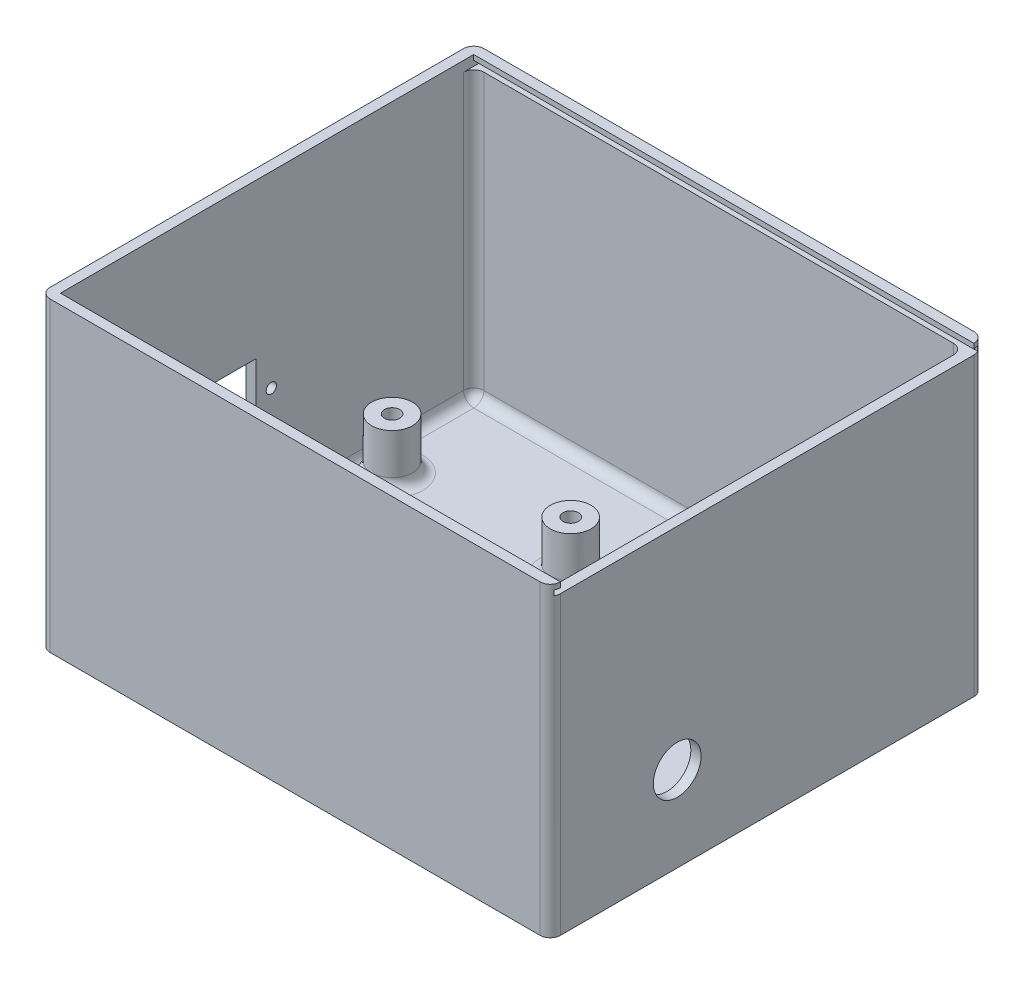
from build123d import *

# Parameters (mm, degrees)
SKETCH2_W           = 100
SKETCH2_H           = 85
BOSS_EXTRUDE1_DEPTH = 60
SHELL1_T            = -2
SKETCH3_R           = 4
SKETCH3_R_2         = 1.5
BOSS_EXTRUDE2_DEPTH = 10
SKETCH4_R           = 1
SKETCH4_W           = 20
SKETCH4_H           = 13
CUT_EXTRUDE1_DEPTH  = 10
SKETCH5_R           = 4.675055564
CUT_EXTRUDE2_DEPTH  = 10
SKETCH6_W           = 81
SKETCH6_H           = 2
CUT_EXTRUDE3_DEPTH  = 10
SKETCH7_W           = 98
SKETCH7_H           = 1
CUT_EXTRUDE4_DEPTH  = 1
SKETCH8_W           = 98
SKETCH8_H           = 1
CUT_EXTRUDE5_DEPTH  = 1
FILLET1_R           = 2


with BuildPart() as part:
    # Sketch2 → Boss-Extrude1 (new body)
    with BuildSketch(Plane(origin=(0, 0, 0), x_dir=(1, 0, 0), z_dir=(0, 1, 0))):
        with Locations((50, 42.5)):
            Rectangle(SKETCH2_W, SKETCH2_H)
    extrude(amount=BOSS_EXTRUDE1_DEPTH)

    # Shell1
    shell1_openings = [part.faces().sort_by_distance(p)[0] for p in [
        (50, 60, -42.5),
    ]]
    offset(amount=SHELL1_T, openings=shell1_openings, kind=Kind.INTERSECTION)

    # Sketch3 → Boss-Extrude2 (add)
    # profile 1 of 6: a face of its own
    with BuildSketch(Plane(origin=(0, 2, 0), x_dir=(1, 0, 0), z_dir=(0, 1, 0))):
        with Locations(Location((7, 62, 0), (0, 0, 90))):
            Circle(SKETCH3_R)
        with Locations(Location((7, 62, 0), (0, 0, 270))):
            Circle(SKETCH3_R_2, mode=Mode.SUBTRACT)
    # profile 2 of 6: a face of its own
    with BuildSketch(Plane(origin=(0, 2, 0), x_dir=(1, 0, 0), z_dir=(0, 1, 0))):
        with Locations(Location((7, 12, 0), (0, 0, 90))):
            Circle(SKETCH3_R)
        with Locations(Location((7, 12, 0), (0, 0, 270))):
            Circle(SKETCH3_R_2, mode=Mode.SUBTRACT)
    # profile 3 of 6: a face of its own
    with BuildSketch(Plane(origin=(0, 2, 0), x_dir=(1, 0, 0), z_dir=(0, 1, 0))):
        with Locations(Location((42, 12, 0), (0, 0, 90))):
            Circle(SKETCH3_R)
        with Locations(Location((42, 12, 0), (0, 0, 270))):
            Circle(SKETCH3_R_2, mode=Mode.SUBTRACT)
    # profile 4 of 6: a face of its own
    with BuildSketch(Plane(origin=(0, 2, 0), x_dir=(1, 0, 0), z_dir=(0, 1, 0))):
        with Locations(Location((42, 62, 0), (0, 0, 90))):
            Circle(SKETCH3_R)
        with Locations(Location((42, 62, 0), (0, 0, 270))):
            Circle(SKETCH3_R_2, mode=Mode.SUBTRACT)
    # profile 5 of 6: a face of its own
    with BuildSketch(Plane(origin=(0, 2, 0), x_dir=(1, 0, 0), z_dir=(0, 1, 0))):
        with Locations(Location((71, 7, 0), (0, 0, 90))):
            Circle(SKETCH3_R)
        with Locations(Location((71, 7, 0), (0, 0, 270))):
            Circle(SKETCH3_R_2, mode=Mode.SUBTRACT)
    # profile 6 of 6: a face of its own
    with BuildSketch(Plane(origin=(0, 2, 0), x_dir=(1, 0, 0), z_dir=(0, 1, 0))):
        with Locations(Location((71, 77, 0), (0, 0, 90))):
            Circle(SKETCH3_R)
        with Locations(Location((71, 77, 0), (0, 0, 270))):
            Circle(SKETCH3_R_2, mode=Mode.SUBTRACT)
    extrude(amount=BOSS_EXTRUDE2_DEPTH)

    # Sketch4 → Cut-Extrude1 (cut)
    with BuildSketch(Plane.ZY):
        with Locations((-43.331926362, 23.212680524)):
            Circle(SKETCH4_R)
        with Locations((-17.331926362, 23.212680524)):
            Circle(SKETCH4_R)
        with Locations((-30.331926362, 23.212680524)):
            Rectangle(SKETCH4_W, SKETCH4_H)
    extrude(amount=-CUT_EXTRUDE1_DEPTH, mode=Mode.SUBTRACT)

    # Sketch5 → Cut-Extrude2 (cut)
    with BuildSketch(Plane(origin=(100, 0, 0), x_dir=(0, 0, -1), z_dir=(1, 0, 0))):
        with Locations((24.873306917, 16.664667804)):
            Circle(SKETCH5_R)
    extrude(amount=-CUT_EXTRUDE2_DEPTH, mode=Mode.SUBTRACT)

    # Sketch6 → Cut-Extrude3 (cut)
    with BuildSketch(Plane(origin=(100, 0, 0), x_dir=(0, 0, -1), z_dir=(1, 0, 0))):
        with Locations((42.5, 59)):
            Rectangle(SKETCH6_W, SKETCH6_H)
    extrude(amount=-CUT_EXTRUDE3_DEPTH, mode=Mode.SUBTRACT)

    # Sketch7 → Cut-Extrude4 (cut)
    with BuildSketch(Plane.XY.offset(-83)):
        with Locations((51, 58.5)):
            Rectangle(SKETCH7_W, SKETCH7_H)
    extrude(amount=-CUT_EXTRUDE4_DEPTH, mode=Mode.SUBTRACT)

    # Sketch8 → Cut-Extrude5 (cut)
    with BuildSketch(Plane(origin=(0, 0, -2), x_dir=(-1, 0, 0), z_dir=(0, 0, -1))):
        with Locations((-51, 58.5)):
            Rectangle(SKETCH8_W, SKETCH8_H)
    extrude(amount=-CUT_EXTRUDE5_DEPTH, mode=Mode.SUBTRACT)

    # Fillet1
    # the kernel refuses this fillet: 2 mm, written as the material it adds along each edge
    with BuildSketch(Plane(origin=(4, 4, -4), x_dir=(0, -1, 0), z_dir=(0, 0, 1))) as fillet1_piece_1_section:
        Polygon((0, 0), (FILLET1_R * 1.02, 0), (FILLET1_R * 1.02, -FILLET1_R * 1.02), (0, -FILLET1_R * 1.02), align=None)
    fillet1_piece_1 = extrude(amount=FILLET1_R * 1.02, mode=Mode.PRIVATE)
    fillet1_piece_1 = fillet1_piece_1 - Plane(origin=(4, 4, -4), x_dir=(0.7071067811865475, 0.7071067811865475, 0), z_dir=(0, 0, 1)) * Sphere(FILLET1_R, mode=Mode.PRIVATE)
    add(fillet1_piece_1)
    with BuildSketch(Plane(origin=(96, 4, -4), x_dir=(0, -1, 0), z_dir=(0, 0, 1))) as fillet1_piece_2_section:
        Polygon((0, 0), (FILLET1_R * 1.02, 0), (FILLET1_R * 1.02, FILLET1_R * 1.02), (0, FILLET1_R * 1.02), align=None)
    fillet1_piece_2 = extrude(amount=FILLET1_R * 1.02, mode=Mode.PRIVATE)
    fillet1_piece_2 = fillet1_piece_2 - Plane(origin=(96, 4, -4), x_dir=(-0.7071067811865475, 0.7071067811865475, 0), z_dir=(0, 0, 1)) * Sphere(FILLET1_R, mode=Mode.PRIVATE)
    add(fillet1_piece_2)
    with BuildSketch(Plane(origin=(96, 4, -81), x_dir=(1, 0, 0), z_dir=(0, -1, 0))) as fillet1_piece_3_section:
        Polygon((0, 0), (FILLET1_R * 1.02, 0), (FILLET1_R * 1.02, -FILLET1_R * 1.02), (0, -FILLET1_R * 1.02), align=None)
    fillet1_piece_3 = extrude(amount=FILLET1_R * 1.02, mode=Mode.PRIVATE)
    fillet1_piece_3 = fillet1_piece_3 - Plane(origin=(96, 4, -81), x_dir=(-0.7071067811865475, 0, 0.7071067811865475), z_dir=(0, -1, 0)) * Sphere(FILLET1_R, mode=Mode.PRIVATE)
    add(fillet1_piece_3)
    with BuildSketch(Plane(origin=(4, 4, -81), x_dir=(0, 0, -1), z_dir=(0, -1, 0))) as fillet1_piece_4_section:
        Polygon((0, 0), (FILLET1_R * 1.02, 0), (FILLET1_R * 1.02, -FILLET1_R * 1.02), (0, -FILLET1_R * 1.02), align=None)
    fillet1_piece_4 = extrude(amount=FILLET1_R * 1.02, mode=Mode.PRIVATE)
    fillet1_piece_4 = fillet1_piece_4 - Plane(origin=(4, 4, -81), x_dir=(0.7071067811865475, 0, 0.7071067811865475), z_dir=(0, -1, 0)) * Sphere(FILLET1_R, mode=Mode.PRIVATE)
    add(fillet1_piece_4)
    with BuildSketch(Plane(origin=(7, 2, -62), x_dir=(0, 0, -1), z_dir=(1, 0, 0))) as fillet1_piece_5:
        with BuildLine():
            CenterArc((4 + FILLET1_R, FILLET1_R), FILLET1_R, 180, 90)
            Line((4, FILLET1_R), (4, 0))
            Line((4, 0), (4 + FILLET1_R, 0))
        make_face()
    revolve(axis=Axis((7, 2, -62), (0, 1, 0)))
    with BuildSketch(Plane(origin=(7, 2, -12), x_dir=(0, 0, -1), z_dir=(1, 0, 0))) as fillet1_piece_6:
        with BuildLine():
            CenterArc((4 + FILLET1_R, FILLET1_R), FILLET1_R, 180, 90)
            Line((4, FILLET1_R), (4, 0))
            Line((4, 0), (4 + FILLET1_R, 0))
        make_face()
    revolve(axis=Axis((7, 2, -12), (0, 1, 0)))
    with BuildSketch(Plane(origin=(71, 2, -77), x_dir=(0, 0, -1), z_dir=(1, 0, 0))) as fillet1_piece_7:
        with BuildLine():
            CenterArc((4 + FILLET1_R, FILLET1_R), FILLET1_R, 180, 90)
            Line((4, FILLET1_R), (4, 0))
            Line((4, 0), (4 + FILLET1_R, 0))
        make_face()
    revolve(axis=Axis((71, 2, -77), (0, 1, 0)))
    with BuildSketch(Plane(origin=(42, 2, -62), x_dir=(0, 0, -1), z_dir=(1, 0, 0))) as fillet1_piece_8:
        with BuildLine():
            CenterArc((4 + FILLET1_R, FILLET1_R), FILLET1_R, 180, 90)
            Line((4, FILLET1_R), (4, 0))
            Line((4, 0), (4 + FILLET1_R, 0))
        make_face()
    revolve(axis=Axis((42, 2, -62), (0, 1, 0)))
    with BuildSketch(Plane(origin=(42, 2, -12), x_dir=(0, 0, -1), z_dir=(1, 0, 0))) as fillet1_piece_9:
        with BuildLine():
            CenterArc((4 + FILLET1_R, FILLET1_R), FILLET1_R, 180, 90)
            Line((4, FILLET1_R), (4, 0))
            Line((4, 0), (4 + FILLET1_R, 0))
        make_face()
    revolve(axis=Axis((42, 2, -12), (0, 1, 0)))
    with BuildSketch(Plane(origin=(71, 2, -7), x_dir=(0, 0, -1), z_dir=(1, 0, 0))) as fillet1_piece_10:
        with BuildLine():
            CenterArc((4 + FILLET1_R, FILLET1_R), FILLET1_R, 180, 90)
            Line((4, FILLET1_R), (4, 0))
            Line((4, 0), (4 + FILLET1_R, 0))
        make_face()
    revolve(axis=Axis((71, 2, -7), (0, 1, 0)))
    with BuildSketch(Plane(origin=(4, 2, -2), x_dir=(0, 1, 0), z_dir=(1, 0, 0))) as fillet1_piece_11:
        with BuildLine():
            CenterArc((FILLET1_R, -FILLET1_R), FILLET1_R, 90, 90)
            Line((0, -FILLET1_R), (0, 0))
            Line((0, 0), (FILLET1_R, 0))
        make_face()
    extrude(amount=92)
    with BuildSketch(Plane(origin=(98, 2, -4), x_dir=(-1, 0, 0), z_dir=(0, 0, -1)), Plane(origin=(2, 2, -81), x_dir=(1, 0, 0), z_dir=(0, 0, 1))) as fillet1_piece_12:
        with BuildLine():
            CenterArc((FILLET1_R, FILLET1_R), FILLET1_R, 180, 90)
            Line((0, FILLET1_R), (0, 0))
            Line((0, 0), (FILLET1_R, 0))
        make_face()
    extrude(amount=77)
    with BuildSketch(Plane(origin=(96, 2, -83), x_dir=(0, 0, 1), z_dir=(-1, 0, 0))) as fillet1_piece_13:
        with BuildLine():
            CenterArc((FILLET1_R, FILLET1_R), FILLET1_R, 180, 90)
            Line((0, FILLET1_R), (0, 0))
            Line((0, 0), (FILLET1_R, 0))
        make_face()
    extrude(amount=92)
    with BuildSketch(Plane(origin=(2, 4, -83), x_dir=(1, 0, 0), z_dir=(0, 1, 0)), Plane(origin=(98, 4, -83), x_dir=(0, 0, 1), z_dir=(0, 1, 0)), Plane(origin=(98, 4, -2), x_dir=(-1, 0, 0), z_dir=(0, 1, 0)), Plane(origin=(2, 58, -2), x_dir=(1, 0, 0), z_dir=(0, -1, 0))) as fillet1_piece_14:
        with BuildLine():
            CenterArc((FILLET1_R, -FILLET1_R), FILLET1_R, 90, 90)
            Line((0, -FILLET1_R), (0, 0))
            Line((0, 0), (FILLET1_R, 0))
        make_face()
    extrude(amount=54)
    # the kernel refuses this fillet: 2 mm, written as the material it takes off along each edge
    with BuildSketch(Plane(origin=(100, -5, 0), x_dir=(-1, 0, 0), z_dir=(0, 1, 0)), Plane(origin=(0, -5, -85), x_dir=(1, 0, 0), z_dir=(0, 1, 0))) as fillet1_2_piece_1:
        with BuildLine():
            CenterArc((FILLET1_R, -FILLET1_R), FILLET1_R, 90, 90)
            Line((0, -FILLET1_R), (0, 0))
            Line((0, 0), (FILLET1_R, 0))
        make_face()
    extrude(amount=70, mode=Mode.SUBTRACT)
    with BuildSketch(Plane(origin=(100, -5, -85), x_dir=(-1, 0, 0), z_dir=(0, 1, 0)), Plane(origin=(0, -5, 0), x_dir=(1, 0, 0), z_dir=(0, 1, 0))) as fillet1_2_piece_2:
        with BuildLine():
            CenterArc((FILLET1_R, FILLET1_R), FILLET1_R, 180, 90)
            Line((0, FILLET1_R), (0, 0))
            Line((0, 0), (FILLET1_R, 0))
        make_face()
    extrude(amount=70, mode=Mode.SUBTRACT)


solid = part.part
